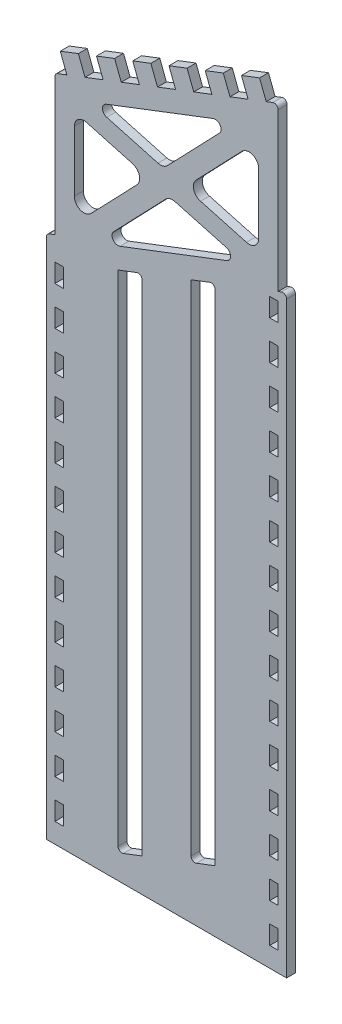
from build123d import *

# Parameters (mm, degrees)
BOSS_EXTRUDE1_DEPTH = 1.4605
SKETCH3_W           = 6.35
SKETCH3_H           = 2.921
BOSS_EXTRUDE2_DEPTH = 6.0452
CUT_EXTRUDE2_DEPTH  = 147.066332108
BOSS_EXTRUDE3_DEPTH = 2.921
SKETCH6_3_W         = 2.75
SKETCH6_3_H         = 6.096
CUT_EXTRUDE3_DEPTH  = 147.77801096
SKETCH6_4_W         = 2.75
SKETCH6_4_H         = 6.096
CUT_EXTRUDE4_DEPTH  = 147.77801096
LPATTERN1_COUNT     = 13
LPATTERN1_PITCH     = 12.7
LPATTERN2_COUNT     = 15
LPATTERN2_PITCH     = 12.7
CUT_EXTRUDE5_DEPTH  = 147.77801096
FILLET1_R           = 1.27
FILLET2_R           = 3.175
FILLET3_R           = 1.905


with BuildPart() as part:
    # Sketch1 → Boss-Extrude1 (new, symmetric)
    with BuildSketch(Plane.XY):
        Polygon((-36.517931963, 109.22), (36.517931963, 137.255841429), (36.517931963, -109.22), (-36.517931963, -109.22), align=None)
    extrude(amount=BOSS_EXTRUDE1_DEPTH, both=True)

    # Sketch3 → Boss-Extrude2 (add)
    with BuildSketch(Plane(origin=(-41.231132307, 107.410771898, 0), x_dir=(0.9335804264972012, 0.35836794954530177, 0), z_dir=(-0.35836794954530177, 0.9335804264972012, 0))):
        with Locations((75.914520953, 0)):
            Rectangle(SKETCH3_W, SKETCH3_H)
        with Locations((63.214520953, 0)):
            Rectangle(SKETCH3_W, SKETCH3_H)
        with Locations((50.514520953, 0)):
            Rectangle(SKETCH3_W, SKETCH3_H)
        with Locations((37.814520953, 0)):
            Rectangle(SKETCH3_W, SKETCH3_H)
        with Locations((25.114520953, 0)):
            Rectangle(SKETCH3_W, SKETCH3_H)
        with Locations((12.414520953, 0)):
            Rectangle(SKETCH3_W, SKETCH3_H)
    extrude(amount=BOSS_EXTRUDE2_DEPTH)

    # Sketch5 → Cut-Extrude2 (cut, through all)
    with BuildSketch(Plane.XY.offset(1.4605)):
        Polygon((-15.875, 63.804079158), (-8.001, 66.82662457), (-8.001, -98.27337543), (-15.875, -101.295920842), align=None)
        Polygon((8.001, 72.969216859), (15.875, 75.991762271), (15.875, -89.108237729), (8.001, -92.130783141), align=None)
    extrude(amount=-CUT_EXTRUDE2_DEPTH, mode=Mode.SUBTRACT)

    # Sketch6 → Boss-Extrude3 (add)
    with BuildSketch(Plane.XY.offset(1.4605)):
        Polygon((-39.267931963, 62.444373904), (-39.267931963, -109.22), (-36.517931963, -109.22), (-36.517931963, 63.5), align=None)
        Polygon((39.267931963, 84.971467525), (36.517931963, 83.915841429), (36.517931963, -109.22), (39.267931963, -109.22), align=None)
    extrude(amount=-BOSS_EXTRUDE3_DEPTH)

    # Sketch6<3> → Cut-Extrude3 (cut, through all)
    with BuildSketch(Plane.XY.offset(1.4605)):
        with Locations((-35.142931963, -99.695)):
            Rectangle(SKETCH6_3_W, SKETCH6_3_H)
    cut_extrude3 = extrude(amount=-CUT_EXTRUDE3_DEPTH, mode=Mode.SUBTRACT)

    # Sketch6<4> → Cut-Extrude4 (cut, through all)
    with BuildSketch(Plane.XY.offset(1.4605)):
        with Locations((35.142931963, -99.695)):
            Rectangle(SKETCH6_4_W, SKETCH6_4_H)
    cut_extrude4 = extrude(amount=-CUT_EXTRUDE4_DEPTH, mode=Mode.SUBTRACT)

    # LPattern1: Cut-Extrude3 ×13
    with Locations(*[(0, i * LPATTERN1_PITCH, 0) for i in range(1, LPATTERN1_COUNT)]):
        add(cut_extrude3, mode=Mode.SUBTRACT)

    # LPattern2: Cut-Extrude4 ×15
    with Locations(*[(0, i * LPATTERN2_PITCH, 0) for i in range(1, LPATTERN2_COUNT)]):
        add(cut_extrude4, mode=Mode.SUBTRACT)

    # Sketch8 → Cut-Extrude5 (cut, through all)
    with BuildSketch(Plane.XY.offset(1.4605)):
        Polygon((-30.167931963, 101.563131556), (-30.167931963, 69.705732639), (-5.981784596, 94.918624218), align=None)
        Polygon((0.9822465, 93.005439988), (-23.203900867, 67.792548409), (25.168393866, 86.360932649), align=None)
        Polygon((-25.168393866, 106.77490878), (-0.9822465, 100.130401441), (23.203900867, 125.34329302), align=None)
        Polygon((30.167931963, 123.43010879), (5.981784596, 98.217217211), (30.167931963, 91.572709873), align=None)
    extrude(amount=-CUT_EXTRUDE5_DEPTH, mode=Mode.SUBTRACT)

    # Fillet1
    fillet1_edges = [part.edges().sort_by_distance(p)[0] for p in [
        (8.001, -92.130783141, 0),
        (-15.875, -101.295920842, 0),
        (-8.001, 66.82662457, 0),
        (15.875, 75.991762271, 0),
        (-39.267931963, 62.444373904, 0),
        (39.267931963, 84.971467525, 0),
        (-36.517931963, 109.22, 0),
        (36.517931963, 137.255841429, 0),
    ]]
    fillet(fillet1_edges, radius=FILLET1_R)

    # Fillet2
    fillet2_edges = [part.edges().sort_by_distance(p)[0] for p in [
        (30.167931963, 91.572709873, 0),
        (30.167931963, 123.43010879, 0),
        (-30.167931963, 69.705732639, 0),
        (-30.167931963, 101.563131556, 0),
        (-5.981784596, 94.918624218, 0),
        (5.981784596, 98.217217211, 0),
        (0.9822465, 93.005439988, 0),
        (-0.9822465, 100.130401441, 0),
    ]]
    fillet(fillet2_edges, radius=FILLET2_R)

    # Fillet3
    fillet3_edges = [part.edges().sort_by_distance(p)[0] for p in [
        (-23.203900867, 67.792548409, 0),
        (25.168393866, 86.360932649, 0),
        (23.203900867, 125.34329302, 0),
        (-25.168393866, 106.77490878, 0),
    ]]
    fillet(fillet3_edges, radius=FILLET3_R)


solid = part.part
